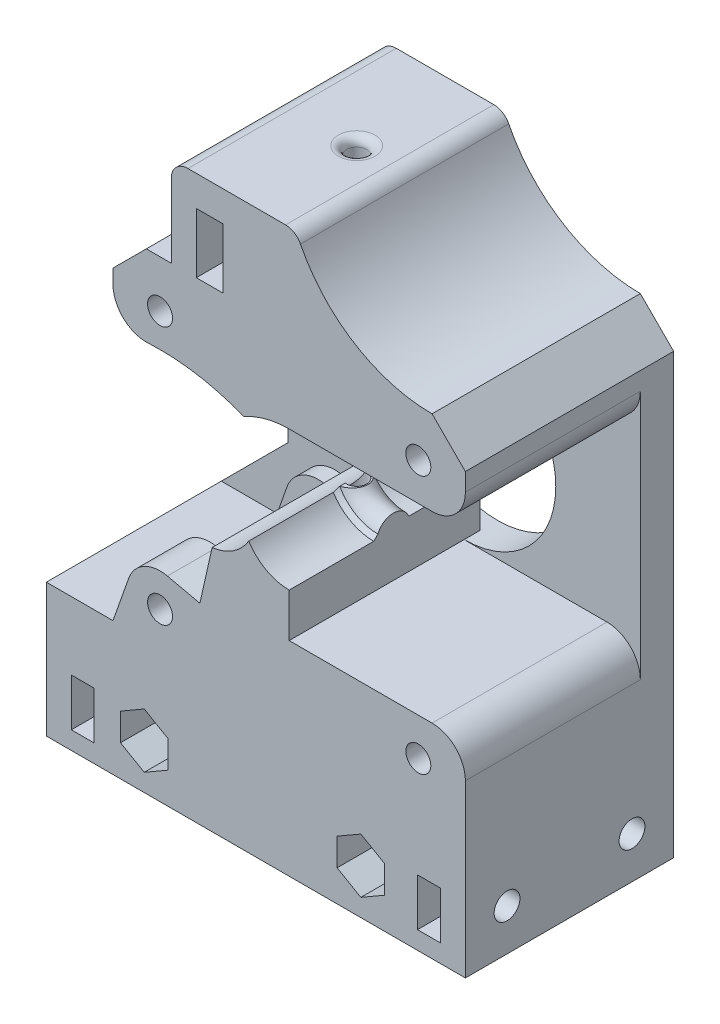
from build123d import *

# Parameters (mm, degrees)
SKETCH2_W                = 42.3
SKETCH2_H                = 67.5
SKETCH2_R                = 11
SKETCH2_R_2              = 1.5
BOSS_EXTRUDE1_DEPTH      = 25
CUT_EXTRUDE1_START       = 3.8
CUT_EXTRUDE1_DEPTH       = 3.8
CUT_EXTRUDE2_DEPTH       = 5
SKETCH6_W                = 9.5
SKETCH6_H                = 10.8
CUT_EXTRUDE3_DEPTH       = 61.61798413
SKETCH7_R                = 1.55
CUT_EXTRUDE4_DEPTH       = 45.134142112
BOSS_EXTRUDE2_START      = -22.9
BOSS_EXTRUDE2_DEPTH      = 22.9
REVOLVE1_ANGLE           = 60.694678
SKETCH8_R                = 1.2
FILAMENT_HOLE_DEPTH      = 68.216162491
SKETCH11_R               = 3
SKETCH11_R_2             = 1.2
CUT_EXTRUDE6_DEPTH       = 5
CUT_EXTRUDE7_START       = -10.64595
CUT_EXTRUDE7_DEPTH       = 10.64595
CHAMFER1_SIZE            = 0.5
CUT_EXTRUDE8_START       = -21
CUT_EXTRUDE8_DEPTH       = 21
CUT_EXTRUDE9_DEPTH       = 47.352696884
SKETCH16_R               = 1.5
BOSS_EXTRUDE4_DEPTH      = 2
CUT_EXTRUDE10_DEPTH      = 4.25
CUT_EXTRUDE10_DEPTH_BACK = 44.172010687
SKETCH17_W               = 3.2
SKETCH17_H               = 7.2
SKETCH18_R               = 2.05
CUT_EXTRUDE11_DEPTH      = 55.115986594
FILLET1_R                = 4
BOSS_EXTRUDE5_START      = -6
SKETCH19_R               = 1.5
BOSS_EXTRUDE5_DEPTH      = 6
CUT_EXTRUDE12_DEPTH      = 49.29671319
FILLET2_R                = 2
CUT_EXTRUDE13_START      = -21
CUT_EXTRUDE13_DEPTH      = 21
FILLET3_R                = 4
SKETCH23_W               = 25
SKETCH23_H               = 16
BOSS_EXTRUDE6_DEPTH      = 8
BOSS_EXTRUDE7_DEPTH      = 4
CUT_EXTRUDE14_DEPTH      = 7
CUT_EXTRUDE15_START      = -3
SKETCH27_R               = 1.55
CUT_EXTRUDE15_DEPTH      = 2.75
SKETCH27_3_R             = 1.55
CUT_EXTRUDE18_DEPTH      = 4
SKETCH29_W               = 8.8
SKETCH29_H               = 10.8
BOSS_EXTRUDE9_DEPTH      = 9.5
FILLET4_R                = 1


# Read off the part's stored shape, not the designer's step: Revolve1
with BuildPart() as part:
    # Sketch2 → Boss-Extrude1 (new body)
    with BuildSketch(Plane.XY):
        with Locations((0, -1.75)):
            Rectangle(SKETCH2_W, SKETCH2_H)
        Circle(SKETCH2_R, mode=Mode.SUBTRACT)
        with Locations((-15.5, 15.5)):
            Circle(SKETCH2_R_2, mode=Mode.SUBTRACT)
        with Locations((15.5, 15.5)):
            Circle(SKETCH2_R_2, mode=Mode.SUBTRACT)
        with Locations((15.5, -15.5)):
            Circle(SKETCH2_R_2, mode=Mode.SUBTRACT)
        with Locations((-15.5, -15.5)):
            Circle(SKETCH2_R_2, mode=Mode.SUBTRACT)
    extrude(amount=BOSS_EXTRUDE1_DEPTH)

    # Sketch3 → Cut-Revolve1 (revolve, cut)
    with BuildSketch(Plane(origin=(-4.4, 0, 0), x_dir=(0, 0, -1), z_dir=(1, 0, 0)), mode=Mode.PRIVATE) as cut_revolve1_sk:
        Polygon((-12.5, -26.7), (-20.55, -26.7), (-20.55, -30.5), (-18.55, -30.5), (-18.55, -35.5), (-12.5, -35.5), align=None)
    revolve(cut_revolve1_sk.sketch.rotate(Axis((-4.4, -35.5, 12.5), (0, 1, 0)), 180), axis=Axis((-4.4, -35.5, 12.5), (0, 1, 0)), mode=Mode.SUBTRACT)

    # Sketch4 → Cut-Extrude1 (cut)
    with BuildSketch(Plane.XZ.offset(26.7).offset(CUT_EXTRUDE1_START)):
        with BuildLine():
            Line((3.65, 0), (-12.45, 0))
            Line((-12.45, 0), (-12.45, 12.5))
            ThreePointArc((-12.45, 12.5), (-4.4, 20.55), (3.65, 12.5))
            Line((3.65, 12.5), (3.65, 0))
        make_face()
    extrude(amount=-CUT_EXTRUDE1_DEPTH, mode=Mode.SUBTRACT)

    # Sketch5 → Cut-Extrude2 (cut)
    with BuildSketch(Plane.XZ.offset(35.5)):
        with BuildLine():
            Line((-10.45, 0), (1.65, 0))
            Line((1.65, 0), (1.65, 12.5))
            ThreePointArc((1.65, 12.5), (-4.4, 18.55), (-10.45, 12.5))
            Line((-10.45, 12.5), (-10.45, 0))
        make_face()
    extrude(amount=-CUT_EXTRUDE2_DEPTH, mode=Mode.SUBTRACT)

    # Sketch6 → Cut-Extrude3 (cut, through all)
    with BuildSketch(Plane.ZY.offset(21.15)):
        with Locations((4.75, -30.1)):
            Rectangle(SKETCH6_W, SKETCH6_H)
    extrude(amount=-CUT_EXTRUDE3_DEPTH, mode=Mode.SUBTRACT)

    # Sketch7 → Cut-Extrude4 (cut, through all)
    with BuildSketch(Plane(origin=(0, 0, 9.5), x_dir=(-1, 0, 0), z_dir=(0, 0, -1))):
        with Locations((-8.6, -30.1)):
            Circle(SKETCH7_R)
        with Locations((17.4, -30.1)):
            Circle(SKETCH7_R)
    extrude(amount=-CUT_EXTRUDE4_DEPTH, mode=Mode.SUBTRACT)

    # Sketch9 → Boss-Extrude2 (add)
    with BuildSketch(Plane.XY.offset(25).offset(BOSS_EXTRUDE2_START)):
        with BuildLine():
            Line((0, -5.25), (0, -11))
            ThreePointArc((0, -11), (-5.268664681, -9.656146875), (-9.25, -5.95294045))
            ThreePointArc((-9.25, -5.95294045), (-6.480821439, -4.859566056), (-4.578125, -2.569683149))
            ThreePointArc((-4.578125, -2.569683149), (-2.652514229, -4.530636629), (0, -5.25))
        make_face()
    extrude(amount=BOSS_EXTRUDE2_DEPTH)

    # Revolve1 outline → Revolve1 (revolve)
    with BuildSketch(Plane(origin=(0, 0, 0), x_dir=(-0.8720238095238088, -0.4894634568827219, 0), z_dir=(-0.4894634568827219, 0.8720238095238088, 0))):
        with BuildLine():
            Line((5.25, 10.645950378), (5.25, 14.354049622))
            ThreePointArc((5.25, 14.354049622), (4, 12.5), (5.25, 10.645950378))
        make_face()
    revolve(axis=Axis((0, 0, 0), (0, 0, 1)), revolution_arc=REVOLVE1_ANGLE)

    # Sketch8 → filament hole (cut, through all)
    with BuildSketch(Plane.XZ.offset(26.7)):
        with Locations(Location((-4.4, 12.5, 0), (0, 0, 270))):
            Circle(SKETCH8_R)
    extrude(amount=-FILAMENT_HOLE_DEPTH, mode=Mode.SUBTRACT)

    # Sketch11 → Cut-Extrude6 (cut)
    with BuildSketch(Plane(origin=(0, -2.569683149, 0), x_dir=(1, 0, 0), z_dir=(0, 1, 0))):
        with Locations((-4.4, -12.5)):
            Circle(SKETCH11_R)
        with Locations(Location((-4.4, -12.5, 0), (0, 0, 90))):
            Circle(SKETCH11_R_2, mode=Mode.SUBTRACT)
    extrude(amount=CUT_EXTRUDE6_DEPTH, mode=Mode.SUBTRACT)

    # Sketch12 → Cut-Extrude7 (cut)
    with BuildSketch(Plane.XY.offset(25).offset(CUT_EXTRUDE7_START)):
        with BuildLine():
            Line((0, -5.75), (0, -5.25))
            ThreePointArc((0, -5.25), (-2.652514229, -4.530636629), (-4.578125, -2.569683149))
            ThreePointArc((-4.578125, -2.569683149), (-4.709376961, -2.830072058), (-4.853125, -3.083776538))
            ThreePointArc((-4.853125, -3.083776538), (-2.768644516, -5.0395543), (0, -5.75))
        make_face()
    extrude(amount=CUT_EXTRUDE7_DEPTH, mode=Mode.SUBTRACT)

    # Chamfer1
    chamfer1_edges = [part.edges().sort_by_distance(p)[0] for p in [
        (-2.768644516, -5.0395543, 14.35405),
    ]]
    chamfer(chamfer1_edges, length=CHAMFER1_SIZE - 0.0001)  # a hair under: the kernel refuses the full size

    # Sketch14 → Cut-Extrude8 (cut)
    with BuildSketch(Plane.XY.offset(25).offset(CUT_EXTRUDE8_START)):
        with BuildLine():
            Line((-15.5, -19.5), (-21.15, -19.5))
            Line((-21.15, -19.5), (-21.15, 10.902225285))
            ThreePointArc((-21.15, 10.902225285), (-13.197185602, 11.401617904), (-5.444948707, 9.557851933))
            ThreePointArc((-5.444948707, 9.557851933), (-10.683236844, 2.620772889), (-9.25, -5.95294045))
            Line((-9.25, -5.95294045), (-11.597714269, -16.378729809))
            ThreePointArc((-11.597714269, -16.378729809), (-13.001492369, -18.623693266), (-15.5, -19.5))
        make_face()
        Polygon((-21.15, 32), (-21.15, 17.15), (-17.15, 21.15), (-14.15, 21.15), (-14.15, 32), align=None)
    extrude(amount=CUT_EXTRUDE8_DEPTH, mode=Mode.SUBTRACT)

    # Sketch15 → Cut-Extrude9 (cut, through all)
    with BuildSketch(Plane.XY.offset(4)):
        Polygon((-14.15, 32), (-21.15, 32), (-21.15, 17.15), (-17.15, 21.15), (-14.15, 21.15), align=None)
    extrude(amount=-CUT_EXTRUDE9_DEPTH, mode=Mode.SUBTRACT)

    # Sketch16 → Boss-Extrude4 (add)
    with BuildSketch(Plane.XY.offset(4)):
        with BuildLine():
            Line((-21.15, -19.5), (-19.272758099, -14.170979185))
            ThreePointArc((-19.272758099, -14.170979185), (-12.235334377, -13.188732302), (-15.5, -19.5))
            Line((-15.5, -19.5), (-21.15, -19.5))
        make_face()
        with Locations((-15.5, -15.5)):
            Circle(SKETCH16_R, mode=Mode.SUBTRACT)
    extrude(amount=BOSS_EXTRUDE4_DEPTH)

    # Sketch17 → Cut-Extrude10 (cut, two sides: drawn at the far end of the back side and taken through both)
    with BuildSketch(Plane(origin=(0, 0, 12.5), x_dir=(-1, 0, 0), z_dir=(0, 0, -1)).offset(-CUT_EXTRUDE10_DEPTH_BACK)):
        with Locations((9.55, 24.75)):
            Rectangle(SKETCH17_W, SKETCH17_H)
    extrude(amount=CUT_EXTRUDE10_DEPTH + CUT_EXTRUDE10_DEPTH_BACK, mode=Mode.SUBTRACT)

    # Sketch18 → Cut-Extrude11 (cut, through all)
    with BuildSketch(Plane(origin=(-11.15, 0, 0), x_dir=(0, 0, -1), z_dir=(1, 0, 0))):
        with Locations((-12.5, 24.75)):
            Circle(SKETCH18_R)
    extrude(amount=-CUT_EXTRUDE11_DEPTH, mode=Mode.SUBTRACT)

    # Fillet1
    fillet1_edges = [part.edges().sort_by_distance(p)[0] for p in [
        (-21.15, 10.902225285, 14.5),
    ]]
    fillet(fillet1_edges, radius=FILLET1_R)

    # Sketch19 → Boss-Extrude5 (add)
    with BuildSketch(Plane.XY.offset(25).offset(BOSS_EXTRUDE5_START)):
        with BuildLine():
            Line((-14.621270191, -11.597714269), (-10.71898446, -12.476444079))
            Line((-10.71898446, -12.476444079), (-11.597714269, -16.378729809))
            ThreePointArc((-11.597714269, -16.378729809), (-13.001492369, -18.623693266), (-15.5, -19.5))
            Line((-15.5, -19.5), (-21.15, -19.5))
            Line((-21.15, -19.5), (-19.272758099, -14.170979185))
            ThreePointArc((-19.272758099, -14.170979185), (-17.436303958, -11.999896147), (-14.621270191, -11.597714269))
        make_face()
        with Locations((-15.5, -15.5)):
            Circle(SKETCH19_R, mode=Mode.SUBTRACT)
    extrude(amount=BOSS_EXTRUDE5_DEPTH)

    # Sketch21 → Cut-Extrude12 (cut, through all)
    with BuildSketch(Plane(origin=(0, 0, 0), x_dir=(-1, 0, 0), z_dir=(0, 0, -1))):
        with BuildLine():
            Line((-17.15, 21.15), (-21.15, 17.15))
            Line((-21.15, 17.15), (-21.15, 32))
            Line((-21.15, 32), (-0.85, 32))
            ThreePointArc((-0.85, 32), (-7.359539081, 24.110528758), (-17.15, 21.15))
        make_face()
    extrude(amount=-CUT_EXTRUDE12_DEPTH, mode=Mode.SUBTRACT)

    # Fillet2
    fillet2_edges = [part.edges().sort_by_distance(p)[0] for p in [
        (-14.15, 32, 12.5),
        (0.85, 32, 12.5),
    ]]
    fillet(fillet2_edges, radius=FILLET2_R)

    # Sketch22 → Cut-Extrude13 (cut)
    with BuildSketch(Plane.XY.offset(25).offset(CUT_EXTRUDE13_START)):
        with BuildLine():
            Line((0, -11), (21.15, -11))
            Line((21.15, -11), (21.15, 11))
            Line((21.15, 11), (0, 11))
            ThreePointArc((0, 11), (11, 0), (0, -11))
        make_face()
    extrude(amount=CUT_EXTRUDE13_DEPTH, mode=Mode.SUBTRACT)

    # Fillet3
    fillet3_edges = [part.edges().sort_by_distance(p)[0] for p in [
        (21.15, 11, 14.5),
        (21.15, -11, 14.5),
    ]]
    fillet(fillet3_edges, radius=FILLET3_R)

    # Sketch23 → Boss-Extrude6 (add)
    with BuildSketch(Plane.ZY.offset(21.15)):
        with Locations((12.5, -27.5)):
            Rectangle(SKETCH23_W, SKETCH23_H)
    extrude(amount=BOSS_EXTRUDE6_DEPTH)

    # Sketch24 → Boss-Extrude7 (add)
    with BuildSketch(Plane(origin=(0, 0, 0), x_dir=(-1, 0, 0), z_dir=(0, 0, -1))):
        Polygon((29.15, -19.5), (21.15, -11.5), (21.15, -19.5), align=None)
    extrude(amount=-BOSS_EXTRUDE7_DEPTH)

    # Sketch25 → Cut-Extrude14 (cut)
    with BuildSketch(Plane.XY.offset(25)):
        Polygon((-17.4, -33.390896534), (-14.55, -31.745448267), (-14.55, -28.454551733), (-17.4, -26.809103466), (-20.25, -28.454551733), (-20.25, -31.745448267), align=None)
        Polygon((11.45, -31.745448267), (11.45, -28.454551733), (8.6, -26.809103466), (5.75, -28.454551733), (5.75, -31.745448267), (8.6, -33.390896534), align=None)
    extrude(amount=-CUT_EXTRUDE14_DEPTH, mode=Mode.SUBTRACT)

    # Sketch27 → Cut-Extrude15 (cut)
    # profile 1 of 4: a face of its own
    with BuildSketch(Plane.ZY.offset(29.15).offset(CUT_EXTRUDE15_START)):
        Polygon((0, -33.35), (3.354551733, -33.35), (6.645448267, -33.35), (8.290896534, -30.5), (6.645448267, -27.65), (3.354551733, -27.65), (0, -27.65), align=None)
        with Locations((5, -30.5)):
            Circle(SKETCH27_R, mode=Mode.SUBTRACT)
    # profile 2 of 4: a face of its own
    with BuildSketch(Plane.ZY.offset(29.15).offset(CUT_EXTRUDE15_START)):
        with Locations((5, -30.5)):
            Circle(SKETCH27_R)
    # profile 3 of 4: a face of its own
    with BuildSketch(Plane.ZY.offset(29.15).offset(CUT_EXTRUDE15_START)):
        Polygon((25, -27.65), (21.645448267, -27.65), (18.354551733, -27.65), (16.709103466, -30.5), (18.354551733, -33.35), (21.645448267, -33.35), (25, -33.35), align=None)
        with Locations((20, -30.5)):
            Circle(SKETCH27_R, mode=Mode.SUBTRACT)
    # profile 4 of 4: a face of its own
    with BuildSketch(Plane.ZY.offset(29.15).offset(CUT_EXTRUDE15_START)):
        with Locations((20, -30.5)):
            Circle(SKETCH27_R)
    cut_extrude15 = extrude(amount=-CUT_EXTRUDE15_DEPTH, mode=Mode.SUBTRACT)

    # Sketch27<3> → Cut-Extrude18 (cut)
    with BuildSketch(Plane.ZY.offset(29.15)):
        with Locations((5, -30.5)):
            Circle(SKETCH27_3_R)
        with Locations((20, -30.5)):
            Circle(SKETCH27_3_R)
    cut_extrude18 = extrude(amount=-CUT_EXTRUDE18_DEPTH, mode=Mode.SUBTRACT)

    # Sketch29 → Boss-Extrude9 (add)
    with BuildSketch(Plane(origin=(0, 0, 9.5), x_dir=(-1, 0, 0), z_dir=(0, 0, -1))):
        with Locations((-16.75, -30.1)):
            Rectangle(SKETCH29_W, SKETCH29_H)
    extrude(amount=BOSS_EXTRUDE9_DEPTH)

    # Mirror2: Cut-Extrude15, Cut-Extrude18 across plane
    add(cut_extrude15.mirror(Plane.ZY.offset(4)), mode=Mode.SUBTRACT)
    add(cut_extrude18.mirror(Plane.ZY.offset(4)), mode=Mode.SUBTRACT)

    # Fillet4
    fillet4_edges = [part.edges().sort_by_distance(p)[0] for p in [
        (-4.4, 32, 13.7),
    ]]
    fillet(fillet4_edges, radius=FILLET4_R)


solid = part.part
